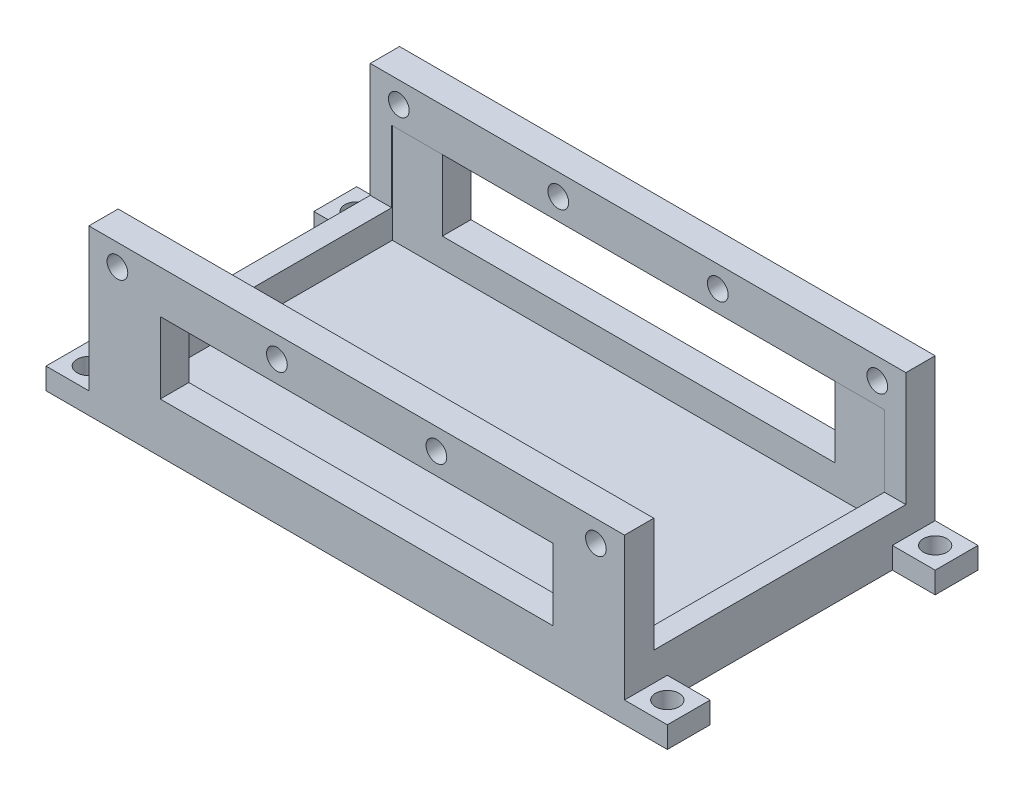
from build123d import *

# Parameters (mm, degrees)
SKETCH1_R           = 1.65
BOSS_EXTRUDE1_DEPTH = 3
SKETCH2_W           = 69
SKETCH2_H           = 35.5
BOSS_EXTRUDE2_DEPTH = 4
BOSS_EXTRUDE3_DEPTH = 10
SKETCH4_W           = 75
SKETCH4_H           = 4.1
BOSS_EXTRUDE4_DEPTH = 6
SKETCH5_R           = 1.45
CUT_EXTRUDE1_DEPTH  = 93.2239123


with BuildPart() as part:
    # Sketch1 → Boss-Extrude1 (new body)
    with BuildSketch(Plane(origin=(0, 0, 0), x_dir=(1, 0, 0), z_dir=(0, 1, 0))):
        Polygon((-78, 39.5), (-78, 33.5), (-72, 33.5), (-72, 2), (-78, 2), (-78, -4), (9, -4), (9, 2), (3, 2), (3, 33.5), (9, 33.5), (9, 39.5), align=None)
        with Locations((6, 36.5)):
            Circle(SKETCH1_R, mode=Mode.SUBTRACT)
        with Locations((6, -1)):
            Circle(SKETCH1_R, mode=Mode.SUBTRACT)
        with Locations((-75, -1)):
            Circle(SKETCH1_R, mode=Mode.SUBTRACT)
        with Locations((-75, 36.5)):
            Circle(SKETCH1_R, mode=Mode.SUBTRACT)
    extrude(amount=BOSS_EXTRUDE1_DEPTH)

    # Sketch2 → Boss-Extrude2 (add)
    with BuildSketch(Plane(origin=(0, 3, 0), x_dir=(1, 0, 0), z_dir=(0, 1, 0))):
        Polygon((-72, 39.5), (-72, 33.5), (-72, 2), (-72, -4), (3, -4), (3, 2), (3, 33.5), (3, 39.5), align=None)
        with Locations((-34.5, 17.75)):
            Rectangle(SKETCH2_W, SKETCH2_H, mode=Mode.SUBTRACT)
    extrude(amount=BOSS_EXTRUDE2_DEPTH)

    # Sketch3 → Boss-Extrude3 (add)
    with BuildSketch(Plane(origin=(0, 7, 0), x_dir=(1, 0, 0), z_dir=(0, 1, 0))):
        Polygon((3, -4), (3, 0.1), (0, 0.1), (0, 0), (-7, 0), (-7, -4), align=None)
        Polygon((3, 39.5), (-7, 39.5), (-7, 35.5), (0, 35.5), (0, 35.4), (3, 35.4), align=None)
        Polygon((-72, 39.5), (-72, 35.4), (-69, 35.4), (-69, 35.5), (-62, 35.5), (-62, 39.5), align=None)
        Polygon((-72, -4), (-62, -4), (-62, 0), (-69, 0), (-69, 0.1), (-72, 0.1), align=None)
    extrude(amount=BOSS_EXTRUDE3_DEPTH)

    # Sketch4 → Boss-Extrude4 (add)
    with BuildSketch(Plane(origin=(0, 17, 0), x_dir=(1, 0, 0), z_dir=(0, 1, 0))):
        with Locations((-34.5, 37.45)):
            Rectangle(SKETCH4_W, SKETCH4_H)
        with Locations((-34.5, -1.95)):
            Rectangle(SKETCH4_W, SKETCH4_H)
    extrude(amount=BOSS_EXTRUDE4_DEPTH)

    # Sketch5 → Cut-Extrude1 (cut, through all)
    with BuildSketch(Plane.XY.offset(4)):
        with Locations((-68, 20)):
            Circle(SKETCH5_R)
        with Locations((-45.666666667, 20)):
            Circle(SKETCH5_R)
        with Locations((-23.333333333, 20)):
            Circle(SKETCH5_R)
        with Locations((-1, 20)):
            Circle(SKETCH5_R)
    extrude(amount=-CUT_EXTRUDE1_DEPTH, mode=Mode.SUBTRACT)


solid = part.part
